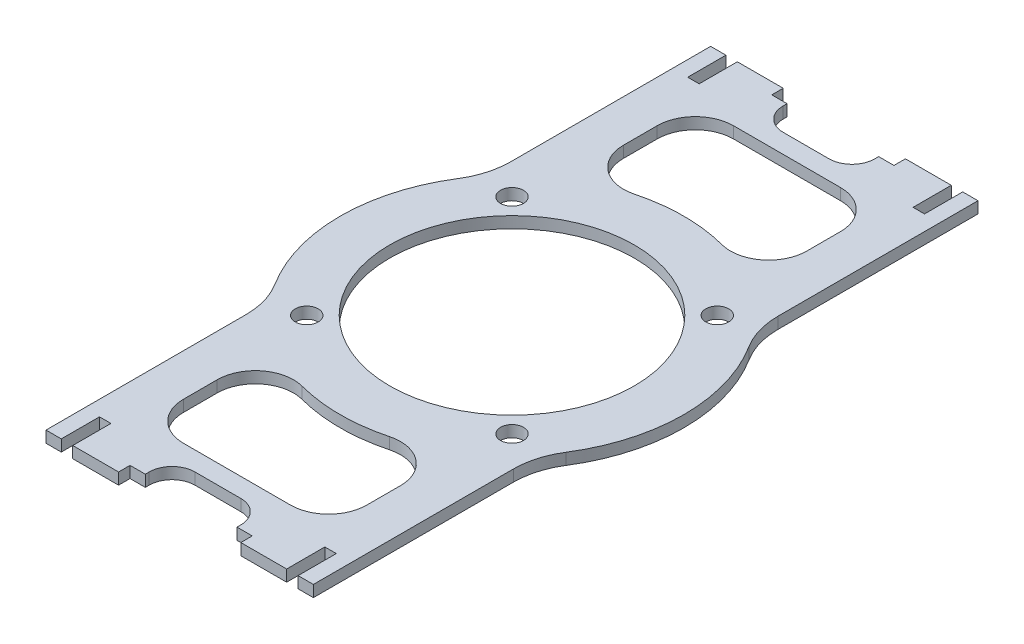
from build123d import *

# Parameters (mm, degrees)
SZKIC1_R                    = 3
SZKIC1_R_2                  = 32
DODANIE_WYCI_GNI_CIE1_DEPTH = 3


with BuildPart() as part:
    # Szkic1 → Dodanie-wyciągnięcie1 (new body)
    with BuildSketch(Plane(origin=(0, 0, 0), x_dir=(1, 0, 0), z_dir=(0, 1, 0))):
        with BuildLine():
            Line((594.712739871, -49.862139829), (594.712739871, -59.862139829))
            Line((594.712739871, -59.862139829), (606.712739871, -59.862139829))
            Line((606.712739871, -59.862139829), (606.712739871, -56.862139829))
            Line((606.712739871, -56.862139829), (610.712739871, -56.862139829))
            Line((610.712739871, -56.862139829), (610.712739871, -55.862139829))
            ThreePointArc((610.712739871, -55.862139829), (612.470099184, -51.619499142), (616.712739871, -49.862139829))
            Line((616.712739871, -49.862139829), (622.712739871, -49.862139829))
            Line((622.712739871, -49.862139829), (628.712739871, -49.862139829))
            ThreePointArc((628.712739871, -49.862139829), (632.955380558, -51.619499142), (634.712739871, -55.862139829))
            Line((634.712739871, -55.862139829), (634.712739871, -56.862139829))
            Line((634.712739871, -56.862139829), (638.712739871, -56.862139829))
            Line((638.712739871, -56.862139829), (638.712739871, -59.862139829))
            Line((638.712739871, -59.862139829), (650.712739871, -59.862139829))
            Line((650.712739871, -59.862139829), (650.712739871, -49.862139829))
            Line((650.712739871, -49.862139829), (653.712739871, -49.862139829))
            Line((653.712739871, -49.862139829), (653.712739871, -59.862139829))
            Line((653.712739871, -59.862139829), (657.712739871, -59.862139829))
            Line((657.712739871, -59.862139829), (657.712739871, -7.503155981))
            ThreePointArc((657.712739871, -7.503155981), (658.497361414, -1.956154018), (660.789662948, 3.15561822))
            ThreePointArc((660.789662948, 3.15561822), (665.947341398, 14.657105756), (667.712739871, 27.137860171))
            ThreePointArc((667.712739871, 27.137860171), (665.947341398, 39.618614586), (660.789662948, 51.120102122))
            ThreePointArc((660.789662948, 51.120102122), (658.497361414, 56.23187436), (657.712739871, 61.778876322))
            Line((657.712739871, 61.778876322), (657.712739871, 114.137860171))
            Line((657.712739871, 114.137860171), (653.712739871, 114.137860171))
            Line((653.712739871, 114.137860171), (653.712739871, 104.137860171))
            Line((653.712739871, 104.137860171), (650.712739871, 104.137860171))
            Line((650.712739871, 104.137860171), (650.712739871, 114.137860171))
            Line((650.712739871, 114.137860171), (638.712739871, 114.137860171))
            Line((638.712739871, 114.137860171), (638.712739871, 111.137860171))
            Line((638.712739871, 111.137860171), (634.712739871, 111.137860171))
            Line((634.712739871, 111.137860171), (634.712739871, 110.137860171))
            ThreePointArc((634.712739871, 110.137860171), (632.955380558, 105.895219484), (628.712739871, 104.137860171))
            Line((628.712739871, 104.137860171), (622.712739871, 104.137860171))
            Line((622.712739871, 104.137860171), (616.712739871, 104.137860171))
            ThreePointArc((616.712739871, 104.137860171), (612.470099184, 105.895219484), (610.712739871, 110.137860171))
            Line((610.712739871, 110.137860171), (610.712739871, 111.137860171))
            Line((610.712739871, 111.137860171), (606.712739871, 111.137860171))
            Line((606.712739871, 111.137860171), (606.712739871, 114.137860171))
            Line((606.712739871, 114.137860171), (594.712739871, 114.137860171))
            Line((594.712739871, 114.137860171), (594.712739871, 104.137860171))
            Line((594.712739871, 104.137860171), (591.712739871, 104.137860171))
            Line((591.712739871, 104.137860171), (591.712739871, 114.137860171))
            Line((591.712739871, 114.137860171), (587.712739871, 114.137860171))
            Line((587.712739871, 114.137860171), (587.712739871, 61.778876322))
            ThreePointArc((587.712739871, 61.778876322), (586.928118327, 56.23187436), (584.635816794, 51.120102122))
            ThreePointArc((584.635816794, 51.120102122), (579.478138343, 39.618614586), (577.712739871, 27.137860171))
            ThreePointArc((577.712739871, 27.137860171), (579.478138343, 14.657105756), (584.635816794, 3.15561822))
            ThreePointArc((584.635816794, 3.15561822), (586.928118327, -1.956154018), (587.712739871, -7.503155981))
            Line((587.712739871, -7.503155981), (587.712739871, -59.862139829))
            Line((587.712739871, -59.862139829), (591.712739871, -59.862139829))
            Line((591.712739871, -59.862139829), (591.712739871, -49.862139829))
            Line((591.712739871, -49.862139829), (594.712739871, -49.862139829))
        make_face()
        with BuildLine():
            Line((622.712739871, -44.862139829), (608.712739871, -44.862139829))
            ThreePointArc((608.712739871, -44.862139829), (601.641672059, -41.933207641), (598.712739871, -34.862139829))
            Line((598.712739871, -34.862139829), (598.712739871, -26.050484417))
            ThreePointArc((598.712739871, -26.050484417), (602.607600456, -18.130429321), (611.258194416, -16.37987631))
            ThreePointArc((611.258194416, -16.37987631), (616.937713535, -17.490035487), (622.712739871, -17.862139829))
            ThreePointArc((622.712739871, -17.862139829), (628.487766206, -17.490035487), (634.167285325, -16.37987631))
            ThreePointArc((634.167285325, -16.37987631), (642.817879285, -18.130429321), (646.712739871, -26.050484417))
            Line((646.712739871, -26.050484417), (646.712739871, -34.862139829))
            ThreePointArc((646.712739871, -34.862139829), (643.783807683, -41.933207641), (636.712739871, -44.862139829))
            Line((636.712739871, -44.862139829), (622.712739871, -44.862139829))
        make_face(mode=Mode.SUBTRACT)
        with Locations((595.842682186, 0.267802486)):
            Circle(SZKIC1_R, mode=Mode.SUBTRACT)
        with Locations((649.582797556, 0.267802486)):
            Circle(SZKIC1_R, mode=Mode.SUBTRACT)
        with Locations((595.842682186, 54.007917856)):
            Circle(SZKIC1_R, mode=Mode.SUBTRACT)
        with Locations((622.712739871, 27.137860171)):
            Circle(SZKIC1_R_2, mode=Mode.SUBTRACT)
        with BuildLine():
            ThreePointArc((598.712739871, 89.137860171), (601.641672059, 96.208927983), (608.712739871, 99.137860171))
            Line((608.712739871, 99.137860171), (622.712739871, 99.137860171))
            Line((622.712739871, 99.137860171), (636.712739871, 99.137860171))
            ThreePointArc((636.712739871, 99.137860171), (643.783807683, 96.208927983), (646.712739871, 89.137860171))
            Line((646.712739871, 89.137860171), (646.712739871, 80.326204759))
            ThreePointArc((646.712739871, 80.326204759), (642.817879285, 72.406149662), (634.167285325, 70.655596652))
            ThreePointArc((634.167285325, 70.655596652), (628.487766206, 71.765755828), (622.712739871, 72.137860171))
            ThreePointArc((622.712739871, 72.137860171), (616.937713535, 71.765755828), (611.258194416, 70.655596652))
            ThreePointArc((611.258194416, 70.655596652), (602.607600456, 72.406149662), (598.712739871, 80.326204759))
            Line((598.712739871, 80.326204759), (598.712739871, 89.137860171))
        make_face(mode=Mode.SUBTRACT)
        with Locations((649.582797556, 54.007917856)):
            Circle(SZKIC1_R, mode=Mode.SUBTRACT)
    extrude(amount=DODANIE_WYCI_GNI_CIE1_DEPTH)


solid = part.part
